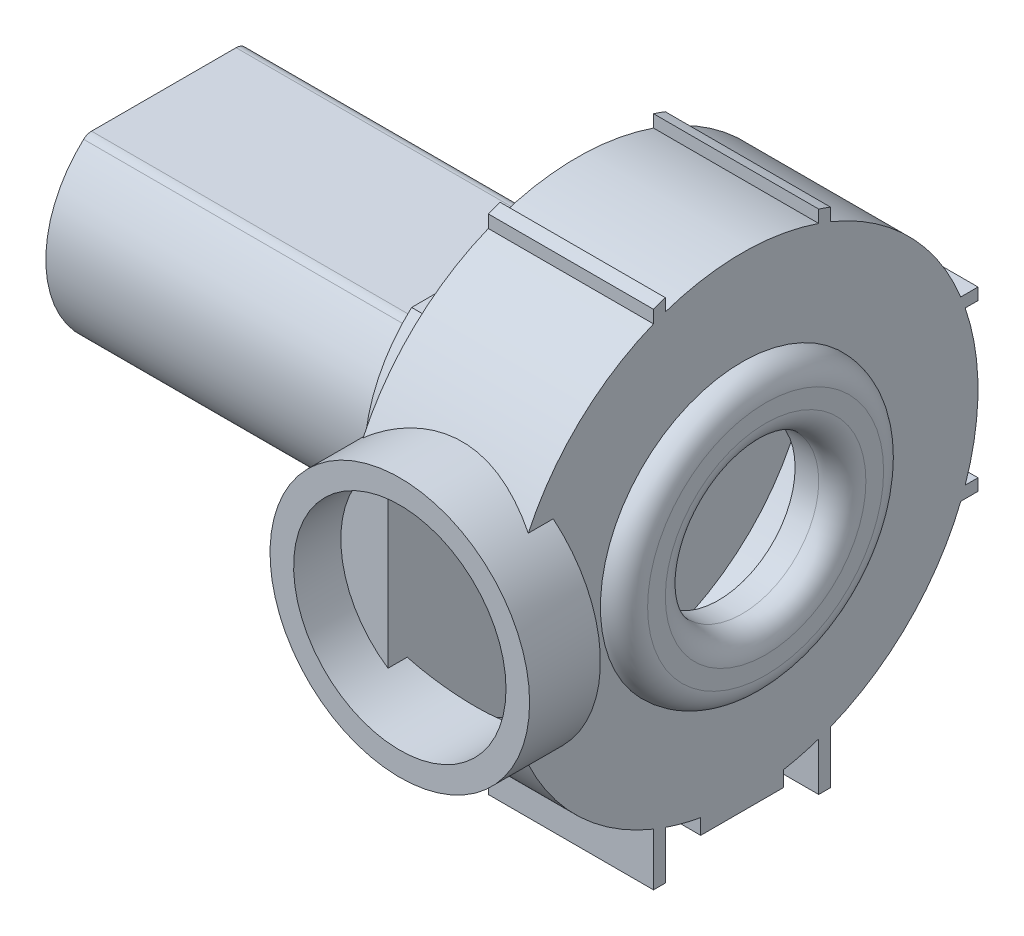
from build123d import *

# Parameters (mm, degrees)
SKETCH2_R                = 20
BOSS_EXTRUDE1_DEPTH      = 14
SKETCH3_R                = 12
SKETCH3_R_2              = 6.5
EXTRUDE_THIN1_DEPTH      = 2
FILLET1_R                = 2
BOSS_EXTRUDE4_REACH      = 34.496
BOSS_EXTRUDE4_END_RADIUS = 21
SKETCH4_W                = 14
SKETCH4_H                = 1
BOSS_EXTRUDE5_DEPTH      = 23
SKETCH6_W                = 6
SKETCH6_H                = 7
BOSS_EXTRUDE6_DEPTH      = 21
BOSS_EXTRUDE7_DEPTH      = 20
BOSS_EXTRUDE8_START      = 16
SKETCH8_R                = 11
BOSS_EXTRUDE8_DEPTH      = 6
SHELL1_START             = 10
SHELL1_DEPTH             = 2
SHELL1_START_2           = -1.5
SHELL1_2_DEPTH           = 23.5
SHELL1_START_3           = 18
SHELL1_3_DEPTH           = 4
SHELL1_START_4           = 2
SHELL1_4_DEPTH           = 10
CUT_EXTRUDE1_REACH       = 38.565
BOSS_EXTRUDE9_DEPTH      = 7
BOSS_EXTRUDE10_DEPTH     = 28
FILLET2_R                = 1


with BuildPart() as part:
    # Sketch2 → Boss-Extrude1 (new body)
    with BuildSketch(Plane(origin=(0, 0, 0), x_dir=(0, 0, -1), z_dir=(1, 0, 0))):
        Circle(SKETCH2_R)
    extrude(amount=BOSS_EXTRUDE1_DEPTH)

    # Sketch3 → Extrude-Thin1 (add)
    with BuildSketch(Plane(origin=(14, 0, 0), x_dir=(0, 0, -1), z_dir=(1, 0, 0))):
        Circle(SKETCH3_R)
        Circle(SKETCH3_R_2, mode=Mode.SUBTRACT)
    extrude(amount=EXTRUDE_THIN1_DEPTH)

    # Fillet1
    fillet1_edges = [part.edges().sort_by_distance(p)[0] for p in [
        (16, 0, 12),
        (16, 0, 6.5),
    ]]
    fillet(fillet1_edges, radius=FILLET1_R - 0.0001)  # a hair under: the kernel refuses the full size

    # Boss-Extrude4: up to this cylinder (the profile starts inside it)
    boss_extrude4_end = Plane(origin=(7, 0, 0), z_dir=(-1, 0, 0)) * Cylinder(BOSS_EXTRUDE4_END_RADIUS, 111.992, mode=Mode.PRIVATE)
    # Sketch4 → Boss-Extrude4 (add, up to the surface)
    with BuildSketch(Plane(origin=(0, 0, 0), x_dir=(1, 0, 0), z_dir=(0, 1, 0)), mode=Mode.PRIVATE) as boss_extrude4_sk1:
        with Locations((7, 7)):
            Rectangle(SKETCH4_W, SKETCH4_H)
    boss_extrude4_tool1 = extrude(boss_extrude4_sk1.sketch, amount=BOSS_EXTRUDE4_REACH, mode=Mode.PRIVATE) & boss_extrude4_end
    add(boss_extrude4_tool1.solids().sort_by_distance((7, 0, -7))[0])
    # Sketch4 → Boss-Extrude4 (add, up to the surface)
    with BuildSketch(Plane(origin=(0, 0, 0), x_dir=(1, 0, 0), z_dir=(0, 1, 0)), mode=Mode.PRIVATE) as boss_extrude4_sk2:
        with Locations((7, -7)):
            Rectangle(SKETCH4_W, SKETCH4_H)
    boss_extrude4_tool2 = extrude(boss_extrude4_sk2.sketch, amount=BOSS_EXTRUDE4_REACH, mode=Mode.PRIVATE) & boss_extrude4_end
    add(boss_extrude4_tool2.solids().sort_by_distance((7, 0, 7))[0])

    # Sketch5 → Boss-Extrude5 (add)
    with BuildSketch(Plane(origin=(0, 0, 0), x_dir=(1, 0, 0), z_dir=(0, 1, 0))):
        Polygon((2, 6.5), (2, -6.5), (14, -6.5), (14, -7.5), (0, -7.5), (0, 7.5), (14, 7.5), (14, 6.5), align=None)
    extrude(amount=-BOSS_EXTRUDE5_DEPTH)

    # Sketch6 → Boss-Extrude6 (add)
    with BuildSketch(Plane(origin=(0, 0, 0), x_dir=(1, 0, 0), z_dir=(0, 1, 0))):
        with Locations((11, 0)):
            Rectangle(SKETCH6_W, SKETCH6_H)
    extrude(amount=-BOSS_EXTRUDE6_DEPTH)

    # Sketch7 → Boss-Extrude7 (add)
    with BuildSketch(Plane.XY):
        Polygon((0, 7.5), (14, 7.5), (14, 6.5), (2, 6.5), (2, -6.5), (14, -6.5), (14, -7.5), (0, -7.5), align=None)
    extrude(amount=-BOSS_EXTRUDE7_DEPTH)

    # Sketch8 → Boss-Extrude8 (add)
    with BuildSketch(Plane.XY.offset(BOSS_EXTRUDE8_START)):
        with Locations(Location((7, 0, 0), (0, 0, 129.521196359))):
            Circle(SKETCH8_R)
    extrude(amount=BOSS_EXTRUDE8_DEPTH)

    # Shell1: read off the stored shape, not the designer's step
    # Shell1 outline → Shell1 (cut)
    with BuildSketch(Plane.YZ.offset(SHELL1_START)):
        with BuildLine():
            Line((-19, -1.5), (-17.937391115, -1.5))
            ThreePointArc((-17.937391115, -1.5), (-18, 0), (-17.937391115, 1.5))
            Line((-17.937391115, 1.5), (-19, 1.5))
            Line((-19, 1.5), (-19, -1.5))
        make_face()
    extrude(amount=SHELL1_DEPTH, mode=Mode.SUBTRACT)

    # Shell1 2 outline → Shell1 2 (cut)
    with BuildSketch(Plane.XY.offset(SHELL1_START_2)):
        with BuildLine():
            Line((2, 7.483314774), (2, -7.483314774))
            ThreePointArc((2, -7.483314774), (7, -9), (12, -7.483314774))
            Line((12, -7.483314774), (12, 7.483314774))
            ThreePointArc((12, 7.483314774), (7, 9), (2, 7.483314774))
        make_face()
    extrude(amount=SHELL1_2_DEPTH, mode=Mode.SUBTRACT)

    # Shell1 3 outline → Shell1 3 (cut)
    with BuildSketch(Plane.XY.offset(SHELL1_START_3)):
        with BuildLine():
            ThreePointArc((2, 7.483314774), (-2, 0), (2, -7.483314774))
            Line((2, -7.483314774), (2, 7.483314774))
        make_face()
        with BuildLine():
            Line((12, 7.483314774), (12, -7.483314774))
            ThreePointArc((12, -7.483314774), (16, 0), (12, 7.483314774))
        make_face()
    extrude(amount=SHELL1_3_DEPTH, mode=Mode.SUBTRACT)

    # Shell1 4 outline → Shell1 4 (cut)
    with BuildSketch(Plane.YZ.offset(SHELL1_START_4)):
        with BuildLine():
            Line((7.483314774, 16.370705544), (3.91902534, 18))
            Line((3.91902534, 18), (-3.91902534, 18))
            Line((-3.91902534, 18), (-7.483314774, 16.370705544))
            ThreePointArc((-7.483314774, 16.370705544), (0, -18), (7.483314774, 16.370705544))
        make_face()
    extrude(amount=SHELL1_4_DEPTH, mode=Mode.SUBTRACT)

    # Sketch9 → Cut-Extrude1 (cut, up to next)
    with BuildSketch(Plane(origin=(14, 0, 0), x_dir=(0, 0, -1), z_dir=(1, 0, 0)), mode=Mode.PRIVATE) as cut_extrude1_sk1:
        with BuildLine():
            ThreePointArc((0, 6.5), (-4.596194078, 4.596194078), (-6.5, 0))
            ThreePointArc((-6.5, 0), (-4.596194078, -4.596194078), (0, -6.5))
            ThreePointArc((0, -6.5), (4.596194078, -4.596194078), (6.5, 0))
            ThreePointArc((6.5, 0), (4.596194078, 4.596194078), (0, 6.5))
        make_face()
    cut_extrude1_tool1 = extrude(cut_extrude1_sk1.sketch, amount=-CUT_EXTRUDE1_REACH, mode=Mode.PRIVATE) & part.part
    add(cut_extrude1_tool1.solids().sort_by_distance((14, 0, 0))[0], mode=Mode.SUBTRACT)

    # Sketch10 → Boss-Extrude9 (add)
    with BuildSketch(Plane.ZY):
        with BuildLine():
            Line((7, 9), (-7, 9))
            ThreePointArc((-7, 9), (-11, 0), (-7, -9))
            Line((-7, -9), (7, -9))
            ThreePointArc((7, -9), (11, 0), (7, 9))
        make_face()
    extrude(amount=BOSS_EXTRUDE9_DEPTH)

    # Sketch11 → Boss-Extrude10 (add)
    with BuildSketch(Plane.ZY.offset(7)):
        with BuildLine():
            Line((-6.5, -7.5), (6.5, -7.5))
            ThreePointArc((6.5, -7.5), (10, 0), (6.5, 7.5))
            Line((6.5, 7.5), (-6.5, 7.5))
            ThreePointArc((-6.5, 7.5), (-10, 0), (-6.5, -7.5))
        make_face()
    extrude(amount=BOSS_EXTRUDE10_DEPTH)

    # Fillet2
    fillet2_edges = [part.edges().sort_by_distance(p)[0] for p in [
        (-21, -7.5, 6.5),
        (-21, 7.5, 6.5),
        (-21, 7.5, -6.5),
        (-21, -7.5, -6.5),
    ]]
    fillet(fillet2_edges, radius=FILLET2_R)


solid = part.part
